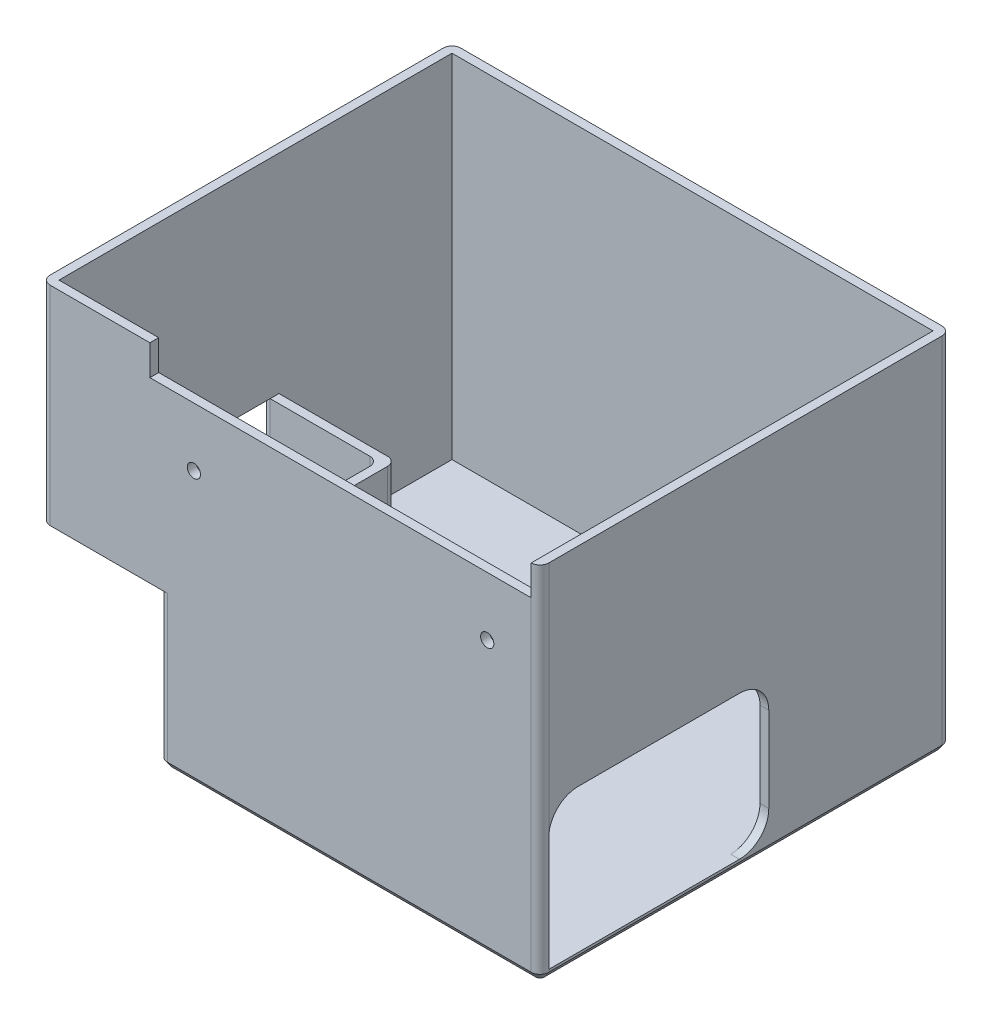
from build123d import *

# Parameters (mm, degrees)
SKETCH1_W           = 170
SKETCH1_H           = 140
BOSS_EXTRUDE1_DEPTH = 3
SKETCH3_W           = 170
SKETCH3_H           = 140
SKETCH3_W_2         = 164
SKETCH3_H_2         = 134
BOSS_EXTRUDE2_DEPTH = 120
CUT_EXTRUDE1_REACH  = 206.827
SKETCH4_W           = 130
SKETCH4_H           = 10.3
SKETCH5_W           = 75
SKETCH5_H           = 52
CUT_EXTRUDE2_DEPTH  = 40
BOSS_EXTRUDE3_DEPTH = 49
CUT_EXTRUDE3_REACH  = 206.827
SKETCH8_R           = 2.25
CUT_EXTRUDE4_REACH  = 223.199
SKETCH9_W           = 75
SKETCH9_H           = 49
FILLET1_R           = 3
CHAMFER1_SIZE       = 1.5
CHAMFER1_SIZE2      = 2.14222201
FILLET2_R           = 10


with BuildPart() as part:
    # Sketch1 → Boss-Extrude1 (new body)
    with BuildSketch(Plane(origin=(0, 0, 0), x_dir=(1, 0, 0), z_dir=(0, 1, 0))):
        Rectangle(SKETCH1_W, SKETCH1_H)
    extrude(amount=BOSS_EXTRUDE1_DEPTH)

    # Sketch3 → Boss-Extrude2 (add)
    with BuildSketch(Plane(origin=(0, 3, 0), x_dir=(1, 0, 0), z_dir=(0, 1, 0))):
        Rectangle(SKETCH3_W, SKETCH3_H)
        Rectangle(SKETCH3_W_2, SKETCH3_H_2, mode=Mode.SUBTRACT)
    extrude(amount=BOSS_EXTRUDE2_DEPTH)

    # Sketch4 → Cut-Extrude1 (cut, up to next)
    with BuildSketch(Plane.XY.offset(70), mode=Mode.PRIVATE) as cut_extrude1_sk1:
        with Locations((17, 117.85)):
            Rectangle(SKETCH4_W, SKETCH4_H)
    cut_extrude1_tool1 = extrude(cut_extrude1_sk1.sketch, amount=-CUT_EXTRUDE1_REACH, mode=Mode.PRIVATE) & part.part
    add(cut_extrude1_tool1.solids().sort_by_distance((17, 117.85, 70))[0], mode=Mode.SUBTRACT)

    # Sketch5 → Cut-Extrude2 (cut)
    with BuildSketch(Plane.ZY.offset(85)):
        with Locations((32.5, 26)):
            Rectangle(SKETCH5_W, SKETCH5_H)
    extrude(amount=-CUT_EXTRUDE2_DEPTH, mode=Mode.SUBTRACT)

    # Sketch6 → Boss-Extrude3 (add)
    with BuildSketch(Plane(origin=(0, 3, 0), x_dir=(1, 0, 0), z_dir=(0, 1, 0))):
        Polygon((-45, 5), (-45, -67), (-42, -67), (-42, 8), (-82, 8), (-82, 5), align=None)
    extrude(amount=BOSS_EXTRUDE3_DEPTH)

    # Sketch8 → Cut-Extrude3 (cut, up to next)
    with BuildSketch(Plane.XY.offset(70), mode=Mode.PRIVATE) as cut_extrude3_sk1:
        with Locations((67, 92.7)):
            Circle(SKETCH8_R)
    cut_extrude3_tool1 = extrude(cut_extrude3_sk1.sketch, amount=-CUT_EXTRUDE3_REACH, mode=Mode.PRIVATE) & part.part
    # Sketch8 → Cut-Extrude3 (cut, up to next)
    with BuildSketch(Plane.XY.offset(70), mode=Mode.PRIVATE) as cut_extrude3_sk2:
        with Locations((-33, 92.7)):
            Circle(SKETCH8_R)
    cut_extrude3_tool2 = extrude(cut_extrude3_sk2.sketch, amount=-CUT_EXTRUDE3_REACH, mode=Mode.PRIVATE) & part.part
    add(cut_extrude3_tool1.solids().sort_by_distance((67, 92.7, 70))[0], mode=Mode.SUBTRACT)
    add(cut_extrude3_tool2.solids().sort_by_distance((-33, 92.7, 70))[0], mode=Mode.SUBTRACT)

    # Sketch9 → Cut-Extrude4 (cut, up to next)
    with BuildSketch(Plane(origin=(85, 0, 0), x_dir=(0, 0, -1), z_dir=(1, 0, 0)), mode=Mode.PRIVATE) as cut_extrude4_sk1:
        with Locations((-29.5, 27.5)):
            Rectangle(SKETCH9_W, SKETCH9_H)
    cut_extrude4_tool1 = extrude(cut_extrude4_sk1.sketch, amount=-CUT_EXTRUDE4_REACH, mode=Mode.PRIVATE) & part.part
    add(cut_extrude4_tool1.solids().sort_by_distance((85, 27.5, 29.5))[0], mode=Mode.SUBTRACT)

    # Fillet1
    fillet1_edges = [part.edges().sort_by_distance(p)[0] for p in [
        (-45, 26, -5),
        (-45, 26, 70),
        (-85, 26, -5),
        (-42, 27.5, -8),
        (85, 61.5, 70),
        (-85, 87.5, 70),
        (-85, 61.5, -70),
        (85, 61.5, -70),
    ]]
    fillet(fillet1_edges, radius=FILLET1_R - 0.0001)  # a hair under: the kernel refuses the full size

    # Chamfer1
    chamfer1_edges = [part.edges().sort_by_distance(p)[0] for p in [
        (-45, 0, 32.5),
        (20, 0, 70),
        (-65, 0, -5),
        (-85, 0, -37.5),
        (0, 0, -70),
        (85, 0, 0),
        (-84.121349633, 0, -69.121349633),
        (84.121349633, 0, 69.121349633),
        (84.121349633, 0, -69.121349633),
        (-84.121349633, 0, -5.878650367),
        (-44.121349633, 0, 69.121349633),
        (-45.878650367, 0, -4.121349633),
    ]]
    chamfer1_side = [part.faces().sort_by_distance(p)[0] for p in [
        (9.378358702, 0, -4.68911711),
    ]]
    chamfer(chamfer1_edges, length=CHAMFER1_SIZE, length2=CHAMFER1_SIZE2, reference=chamfer1_side[0])

    # Fillet2
    fillet2_edges = [part.edges().sort_by_distance(p)[0] for p in [
        (83.5, 52, 67),
        (83.5, 52, -8),
        (83.5, 3, -8),
    ]]
    fillet(fillet2_edges, radius=FILLET2_R)


solid = part.part
